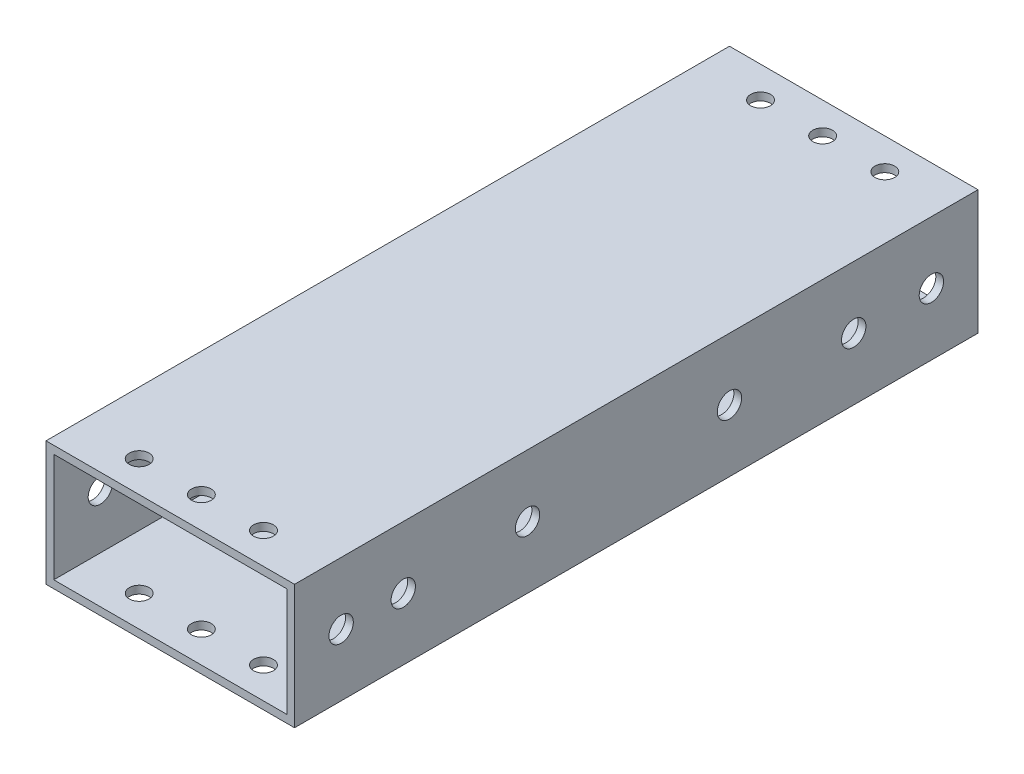
from build123d import *

# Parameters (mm, degrees)
SKETCH1_W           = 50.8
SKETCH1_H           = 25.4
SKETCH1_W_2         = 47.625
SKETCH1_H_2         = 22.225
BOSS_EXTRUDE1_DEPTH = 69.85
SKETCH2_R           = 2.0193
CUT_EXTRUDE1_DEPTH  = 79.545162168
SKETCH3_R           = 2.4892
CUT_EXTRUDE2_DEPTH  = 88.298066989


with BuildPart() as part:
    # Sketch1 → Boss-Extrude1 (new, symmetric)
    with BuildSketch(Plane.XY):
        Rectangle(SKETCH1_W, SKETCH1_H)
        Rectangle(SKETCH1_W_2, SKETCH1_H_2, mode=Mode.SUBTRACT)
    extrude(amount=BOSS_EXTRUDE1_DEPTH, both=True)

    # Sketch2 → Cut-Extrude1 (cut, through all)
    with BuildSketch(Plane(origin=(0, 12.7, 0), x_dir=(1, 0, 0), z_dir=(0, 1, 0))):
        with Locations((-12.7, 63.5)):
            Circle(SKETCH2_R)
        with Locations((0, 63.5)):
            Circle(SKETCH2_R)
        with Locations((12.7, 63.5)):
            Circle(SKETCH2_R)
        with Locations((12.7, -63.5)):
            Circle(SKETCH2_R)
        with Locations((0, -63.5)):
            Circle(SKETCH2_R)
        with Locations((-12.7, -63.5)):
            Circle(SKETCH2_R)
    extrude(amount=-CUT_EXTRUDE1_DEPTH, mode=Mode.SUBTRACT)

    # Sketch3 → Cut-Extrude2 (cut, through all)
    with BuildSketch(Plane(origin=(25.4, 0, 0), x_dir=(0, 0, -1), z_dir=(1, 0, 0))):
        with Locations((60.325, 0)):
            Circle(SKETCH3_R)
        with Locations((44.45, 0)):
            Circle(SKETCH3_R)
        with Locations((19.05, 0)):
            Circle(SKETCH3_R)
        with Locations((-60.325, 0)):
            Circle(SKETCH3_R)
        with Locations((-47.625, 0)):
            Circle(SKETCH3_R)
        with Locations((-22.225, 0)):
            Circle(SKETCH3_R)
    extrude(amount=-CUT_EXTRUDE2_DEPTH, mode=Mode.SUBTRACT)


solid = part.part
